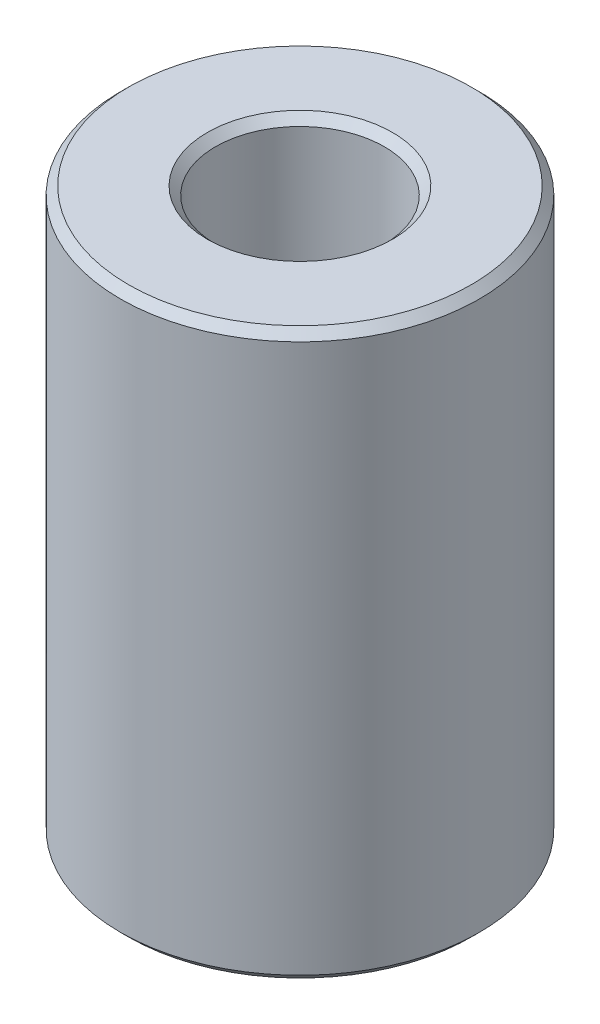
from build123d import *

# Parameters (mm, degrees)
SKETCH1_R           = 47.5
BOSS_EXTRUDE1_DEPTH = 149.480980755
SKETCH2_R           = 22.33060498
CUT_EXTRUDE1_DEPTH  = 164.881248492
CHAMFER1_SIZE       = 2.170988942


with BuildPart() as part:
    # Sketch1 → Boss-Extrude1 (new body)
    with BuildSketch(Plane(origin=(0, 0, 0), x_dir=(1, 0, 0), z_dir=(0, 1, 0))):
        Circle(SKETCH1_R)
    extrude(amount=BOSS_EXTRUDE1_DEPTH)

    # Sketch2 → Cut-Extrude1 (cut, through all)
    with BuildSketch(Plane(origin=(0, 0, 0), x_dir=(1, 0, 0), z_dir=(0, 1, 0))):
        Circle(SKETCH2_R)
    extrude(amount=CUT_EXTRUDE1_DEPTH, mode=Mode.SUBTRACT)

    # Chamfer1
    chamfer1_edges = [part.edges().sort_by_distance(p)[0] for p in [
        (-22.33060498, 149.480980755, 0),
        (-22.33060498, 0, 0),
        (-47.5, 0, 0),
        (-47.5, 149.480980755, 0),
    ]]
    chamfer(chamfer1_edges, length=CHAMFER1_SIZE)


solid = part.part
